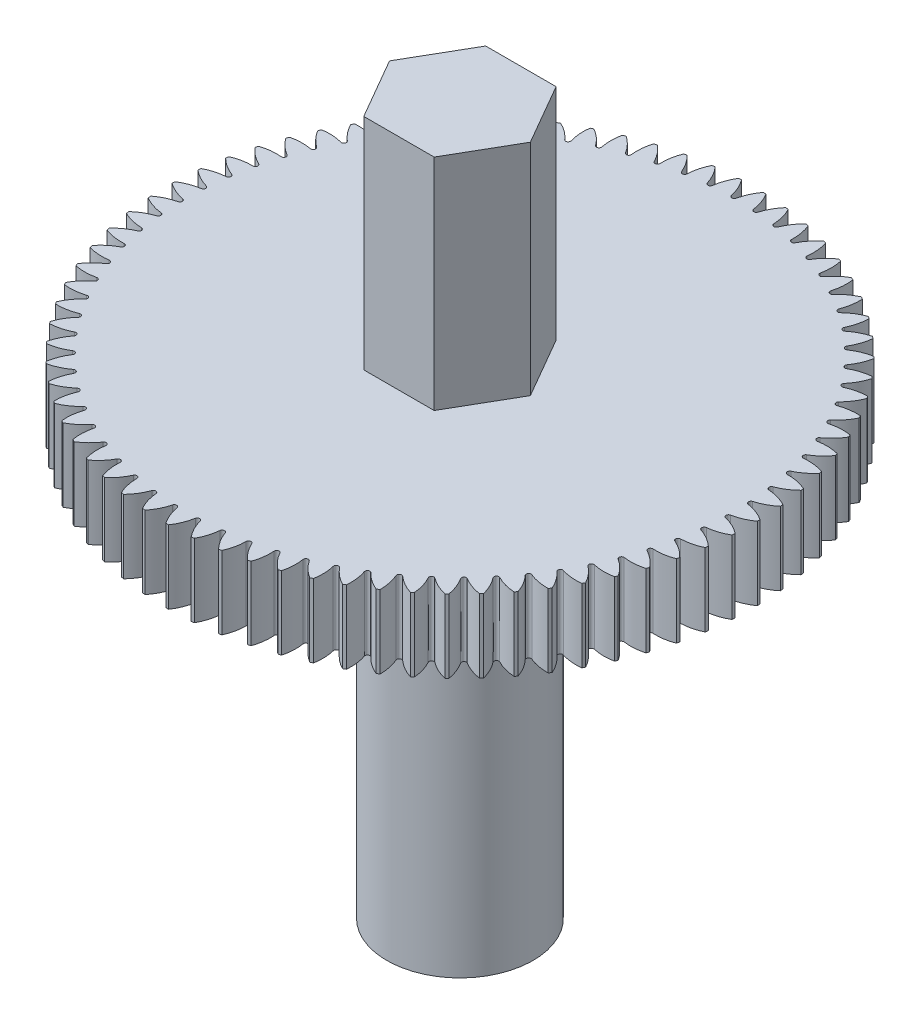
from build123d import *

# Parameters (mm, degrees)
CUT_EXTRUDE_1_DEPTH      = 4
PATTERN_CIRCULAR_1_COUNT = 75
CUT_EXTRUDE_START        = -9
SKETCH_3_R               = 3
CUT_EXTRUDE_2_DEPTH      = 9


with BuildPart() as part:
    # 草图1 → 旋转1 (revolve)
    with BuildSketch(Plane.XY):
        Polygon((0, 0), (0, 29), (3, 29), (3, 20), (12, 20), (12, 17), (3, 17), (3, 0), align=None)
    revolve(axis=Axis((0, 0, 0), (0, 1, 0)))

    # 草图2 → 切除-拉伸1 (cut)
    with BuildSketch(Plane(origin=(0, 20, 0), x_dir=(1, 0, 0), z_dir=(0, 1, 0))):
        with BuildLine():
            Line((-0.45, 12), (0.45, 12))
            ThreePointArc((0.45, 12), (0.232502333, 11.633226208), (0.097701065, 11.228680948))
            ThreePointArc((0.097701065, 11.228680948), (0, 11.15), (-0.097701065, 11.228680948))
            ThreePointArc((-0.097701065, 11.228680948), (-0.232502333, 11.633226208), (-0.45, 12))
        make_face()
    cut_extrude_1 = extrude(amount=-CUT_EXTRUDE_1_DEPTH, mode=Mode.SUBTRACT)

    # 阵列(圆周)1: 切除-拉伸1 ×75 about axis
    pattern_circular_1_axis = Axis((0, 0, 0), (0, -1, 0))
    for i in range(1, PATTERN_CIRCULAR_1_COUNT):
        add(cut_extrude_1.rotate(pattern_circular_1_axis, i * 360 / PATTERN_CIRCULAR_1_COUNT), mode=Mode.SUBTRACT)

    # 草图3 → 切除-拉伸2 (cut)
    with BuildSketch(Plane(origin=(0, 29, 0), x_dir=(1, 0, 0), z_dir=(0, 1, 0)).offset(CUT_EXTRUDE_START)):
        Circle(SKETCH_3_R)
        Polygon((2.886751346, 0), (1.443375673, 2.5), (-1.443375673, 2.5), (-2.886751346, 0), (-1.443375673, -2.5), (1.443375673, -2.5), align=None, mode=Mode.SUBTRACT)
    extrude(amount=CUT_EXTRUDE_2_DEPTH, mode=Mode.SUBTRACT)


solid = part.part
